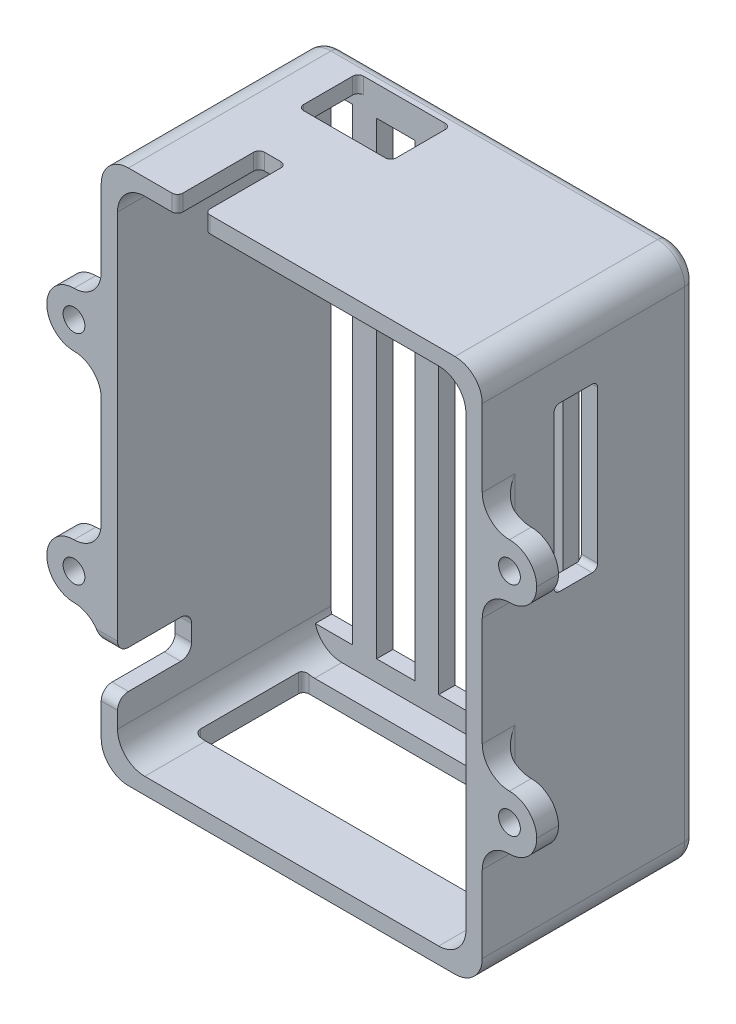
from build123d import *

# Parameters (mm, degrees)
SKETCH1_W           = 7
SKETCH1_H           = 86
BOSS_EXTRUDE1_DEPTH = 3
SKETCH1_3_W         = 70
SKETCH1_3_H         = 98.29
SKETCH1_3_W_2       = 64
SKETCH1_3_H_2       = 92.29
BOSS_EXTRUDE2_DEPTH = 39.2
FILLET2_R           = 5
SKETCH2_W           = 58
SKETCH2_H           = 20
CUT_EXTRUDE1_DEPTH  = 64
FILLET3_R           = 1
SKETCH3_W           = 8
SKETCH3_H           = 30
CUT_EXTRUDE2_DEPTH  = 45
FILLET4_R           = 1
SKETCH4_W           = 5
SKETCH4_H           = 15
CUT_EXTRUDE3_DEPTH  = 81
FILLET5_R           = 1
SKETCH5_W           = 10
SKETCH5_H           = 10
SKETCH5_R           = 2
BOSS_EXTRUDE3_DEPTH = 4
FILLET6_R           = 5
FILLET7_R           = 5
FILLET8_R           = 2
FILLET9_R           = 2
SKETCH6_W           = 13.6
SKETCH6_H           = 7
CUT_EXTRUDE4_DEPTH  = 48
FILLET11_R          = 2
SKETCH7_W           = 17
SKETCH7_H           = 11
CUT_EXTRUDE5_DEPTH  = 60
FILLET12_R          = 1


with BuildPart() as part:
    # Sketch1 → Boss-Extrude1 (new body)
    with BuildSketch(Plane.XY):
        Polygon((-32, -46.145), (32, -46.145), (32, -42.355), (25, -42.355), (25, 43.645), (32, 43.645), (32, 46.145), (-32, 46.145), (-32, 43.645), (-25, 43.645), (-25, -42.355), (-32, -42.355), align=None)
        with Locations((-17.1, 0.645)):
            Rectangle(SKETCH1_W, SKETCH1_H, mode=Mode.SUBTRACT)
        with Locations((-5.7, 0.645)):
            Rectangle(SKETCH1_W, SKETCH1_H, mode=Mode.SUBTRACT)
        with Locations((5.7, 0.645)):
            Rectangle(SKETCH1_W, SKETCH1_H, mode=Mode.SUBTRACT)
        with Locations((17.1, 0.645)):
            Rectangle(SKETCH1_W, SKETCH1_H, mode=Mode.SUBTRACT)
    extrude(amount=BOSS_EXTRUDE1_DEPTH)

    # Sketch1<3> → Boss-Extrude2 (add)
    with BuildSketch(Plane.XY):
        Rectangle(SKETCH1_3_W, SKETCH1_3_H)
        Rectangle(SKETCH1_3_W_2, SKETCH1_3_H_2, mode=Mode.SUBTRACT)
    extrude(amount=BOSS_EXTRUDE2_DEPTH)

    # Fillet2
    fillet2_edges = [part.edges().sort_by_distance(p)[0] for p in [
        (-32, -46.145, 21.1),
        (32, -46.145, 21.1),
        (-32, 46.145, 21.1),
        (32, 46.145, 21.1),
        (35, -49.145, 19.6),
        (-35, -49.145, 19.6),
        (35, 49.145, 19.6),
        (-35, 49.145, 19.6),
    ]]
    fillet(fillet2_edges, radius=FILLET2_R)

    # Sketch2 → Cut-Extrude1 (cut)
    with BuildSketch(Plane(origin=(0, 0, 0), x_dir=(1, 0, 0), z_dir=(0, 1, 0))):
        with Locations((0, -18)):
            Rectangle(SKETCH2_W, SKETCH2_H)
    extrude(amount=-CUT_EXTRUDE1_DEPTH, mode=Mode.SUBTRACT)

    # Fillet3
    fillet3_edges = [part.edges().sort_by_distance(p)[0] for p in [
        (-29, -47.436287847, 28),
        (-29, -47.436287847, 8),
        (29, -47.436287847, 8),
        (29, -47.436287847, 28),
    ]]
    fillet(fillet3_edges, radius=FILLET3_R)

    # Sketch3 → Cut-Extrude2 (cut)
    with BuildSketch(Plane(origin=(0, 0, 0), x_dir=(0, 0, -1), z_dir=(1, 0, 0))):
        with Locations((-22, 22.145)):
            Rectangle(SKETCH3_W, SKETCH3_H)
    extrude(amount=CUT_EXTRUDE2_DEPTH, mode=Mode.SUBTRACT)

    # Fillet4
    fillet4_edges = [part.edges().sort_by_distance(p)[0] for p in [
        (33.5, 37.145, 26),
        (33.5, 7.145, 26),
        (33.5, 7.145, 18),
        (33.5, 37.145, 18),
    ]]
    fillet(fillet4_edges, radius=FILLET4_R)

    # Sketch4 → Cut-Extrude3 (cut)
    with BuildSketch(Plane(origin=(0, 0, 0), x_dir=(1, 0, 0), z_dir=(0, 1, 0))):
        with Locations((-18.5, -31.7)):
            Rectangle(SKETCH4_W, SKETCH4_H)
    extrude(amount=CUT_EXTRUDE3_DEPTH, mode=Mode.SUBTRACT)

    # Fillet5
    fillet5_edges = [part.edges().sort_by_distance(p)[0] for p in [
        (-16, 47.645, 39.2),
        (-21, 47.645, 39.2),
        (-16, 47.645, 24.2),
        (-21, 47.645, 24.2),
    ]]
    fillet(fillet5_edges, radius=FILLET5_R)

    # Sketch5 → Boss-Extrude3 (add)
    # profile 1 of 4: a face of its own
    with BuildSketch(Plane.XY.offset(39.2)):
        with Locations((40, 20)):
            Rectangle(SKETCH5_W, SKETCH5_H)
        with Locations((40, 20)):
            Circle(SKETCH5_R, mode=Mode.SUBTRACT)
    # profile 2 of 4: a face of its own
    with BuildSketch(Plane.XY.offset(39.2)):
        with Locations((40, -20)):
            Rectangle(SKETCH5_W, SKETCH5_H)
        with Locations((40, -20)):
            Circle(SKETCH5_R, mode=Mode.SUBTRACT)
    # profile 3 of 4: a face of its own
    with BuildSketch(Plane.XY.offset(39.2)):
        with Locations((-40, -20)):
            Rectangle(SKETCH5_W, SKETCH5_H)
        with Locations((-40, -20)):
            Circle(SKETCH5_R, mode=Mode.SUBTRACT)
    # profile 4 of 4: a face of its own
    with BuildSketch(Plane.XY.offset(39.2)):
        with Locations((-40, 20)):
            Rectangle(SKETCH5_W, SKETCH5_H)
        with Locations((-40, 20)):
            Circle(SKETCH5_R, mode=Mode.SUBTRACT)
    extrude(amount=-BOSS_EXTRUDE3_DEPTH)

    # Fillet6
    fillet6_edges = [part.edges().sort_by_distance(p)[0] for p in [
        (35, 15, 37.2),
        (35, 25, 37.2),
        (35, -25, 37.2),
        (35, -15, 37.2),
        (-35, -15, 37.2),
        (-35, -25, 37.2),
        (-35, 25, 37.2),
        (-35, 15, 37.2),
    ]]
    fillet(fillet6_edges, radius=FILLET6_R)

    # Fillet7
    fillet7_edges = [part.edges().sort_by_distance(p)[0] for p in [
        (-45, 25, 37.2),
        (-45, 15, 37.2),
        (-45, -15, 37.2),
        (-45, -25, 37.2),
        (45, -25, 37.2),
        (45, -15, 37.2),
        (45, 15, 37.2),
        (45, 25, 37.2),
    ]]
    fillet(fillet7_edges, radius=FILLET7_R - 0.0001)  # a hair under: the kernel refuses the full size

    # Fillet8
    fillet8_edges = [part.edges().sort_by_distance(p)[0] for p in [
        (35, 20, 35.2),
        (35, -20, 35.2),
        (-35, -20, 35.2),
        (-35, 20, 35.2),
    ]]
    fillet(fillet8_edges, radius=FILLET8_R)

    # Fillet9
    fillet9_edges = [part.edges().sort_by_distance(p)[0] for p in [
        (35, 0, 0),
        (-35, 0, 0),
        (0, 49.145, 0),
        (0, -49.145, 0),
        (-33.535533906, 47.680533906, 0),
        (33.535533906, 47.680533906, 0),
        (-33.535533906, -47.680533906, 0),
        (33.535533906, -47.680533906, 0),
    ]]
    fillet(fillet9_edges, radius=FILLET9_R)

    # Sketch6 → Cut-Extrude4 (cut)
    with BuildSketch(Plane(origin=(0, 0, 0), x_dir=(0, 0, -1), z_dir=(1, 0, 0))):
        with Locations((-32.4, -32.645)):
            Rectangle(SKETCH6_W, SKETCH6_H)
    extrude(amount=-CUT_EXTRUDE4_DEPTH, mode=Mode.SUBTRACT)

    # Fillet11
    fillet11_edges = [part.edges().sort_by_distance(p)[0] for p in [
        (-33.5, -29.145, 25.6),
        (-33.5, -36.145, 25.6),
        (-33.5, -36.145, 39.2),
        (-33.536822428, -29.145, 39.2),
    ]]
    fillet(fillet11_edges, radius=FILLET11_R)

    # Sketch7 → Cut-Extrude5 (cut)
    with BuildSketch(Plane(origin=(0, 0, 0), x_dir=(1, 0, 0), z_dir=(0, 1, 0))):
        with Locations((-15.5, -8.5)):
            Rectangle(SKETCH7_W, SKETCH7_H)
    extrude(amount=CUT_EXTRUDE5_DEPTH, mode=Mode.SUBTRACT)

    # Fillet12
    fillet12_edges = [part.edges().sort_by_distance(p)[0] for p in [
        (-24, 47.645, 14),
        (-7, 47.645, 3),
        (-24, 47.645, 3),
        (-7, 47.645, 14),
    ]]
    fillet(fillet12_edges, radius=FILLET12_R)


solid = part.part
